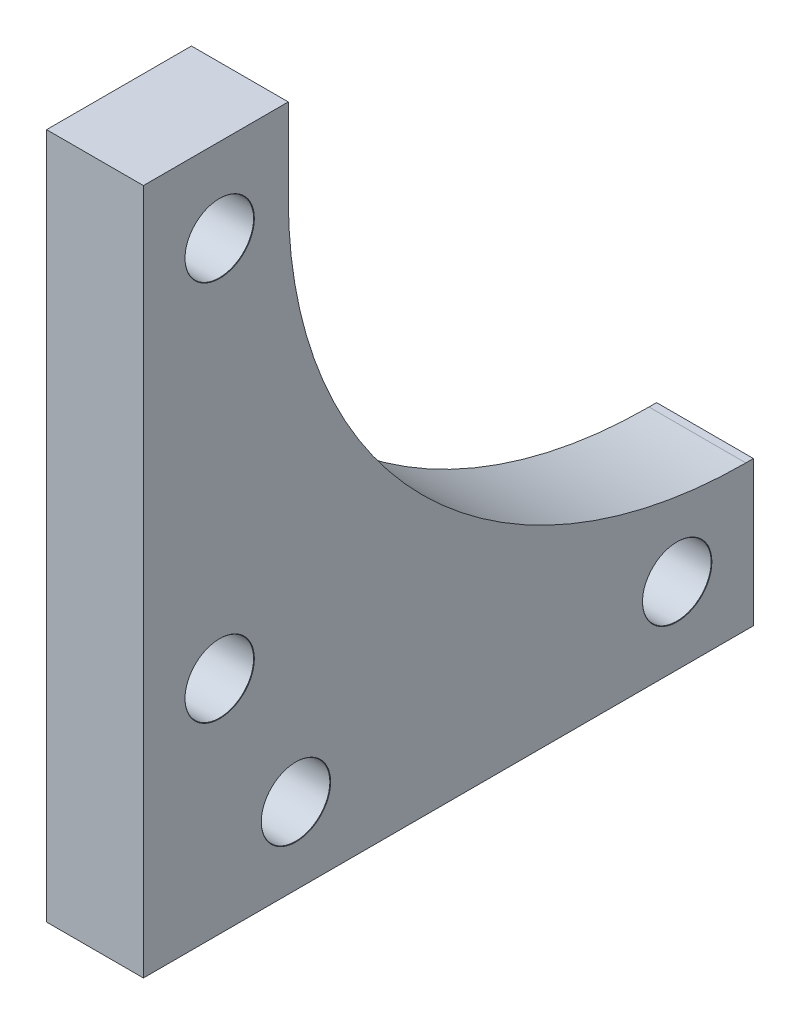
from build123d import *

# Parameters (mm, degrees)
BOSS_EXTRUDE1_DEPTH            = 6.35
M4_CLEARANCE_HOLE1_D           = 4.5
M4_CLEARANCE_HOLE1_CSINK_D     = 4.55
M4_CLEARANCE_HOLE1_CSINK_ANGLE = 90
FILLET1_R                      = 30


with BuildPart() as part:
    # Sketch1 → Boss-Extrude1 (new body)
    with BuildSketch(Plane(origin=(0, 0, 0), x_dir=(0, 0, -1), z_dir=(1, 0, 0))):
        Polygon((0, 0), (0, 45), (9.5, 45), (9.5, 9.5), (40, 9.5), (40, 0), align=None)
    extrude(amount=BOSS_EXTRUDE1_DEPTH)

    # M4 Clearance Hole1 (through all)
    with Locations(Plane(origin=(6.35, 0, 0), x_dir=(0, 0, -1), z_dir=(1, 0, 0))):
        with Locations((35, 5), (10, 5), (5, 39.5), (5, 14.5)):
            CounterSinkHole(M4_CLEARANCE_HOLE1_D / 2, M4_CLEARANCE_HOLE1_CSINK_D / 2, counter_sink_angle=M4_CLEARANCE_HOLE1_CSINK_ANGLE)

    # Fillet1
    fillet1_edges = [part.edges().sort_by_distance(p)[0] for p in [
        (3.175, 9.5, -9.5),
    ]]
    fillet(fillet1_edges, radius=FILLET1_R)


solid = part.part
